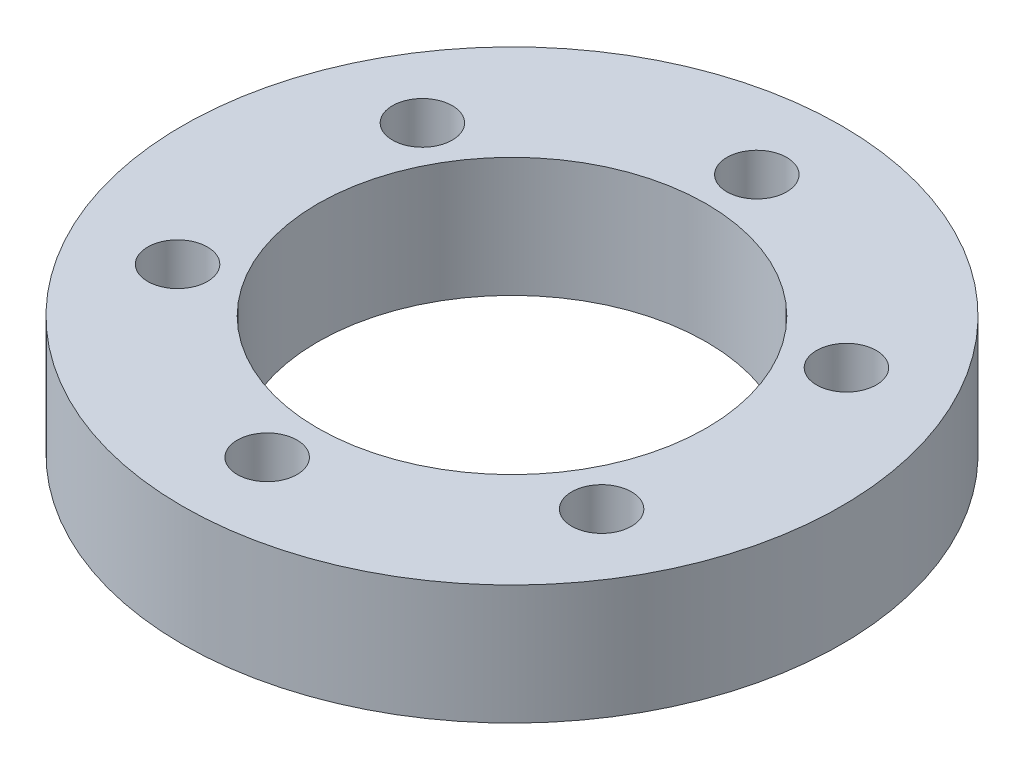
from build123d import *

# Parameters (mm, degrees)
SKETCH1_R           = 35
SKETCH1_R_2         = 10
BOSS_EXTRUDE1_DEPTH = 12.7
SKETCH3_R           = 20.6375
CUT_EXTRUDE1_DEPTH  = 12.7
SKETCH4_R           = 3.175
CUT_EXTRUDE2_DEPTH  = 52.100782773
CIRPATTERN1_COUNT   = 6


with BuildPart() as part:
    # Sketch1 → Boss-Extrude1 (new body)
    with BuildSketch(Plane(origin=(0, 0, 0), x_dir=(1, 0, 0), z_dir=(0, 1, 0))):
        Circle(SKETCH1_R)
        Circle(SKETCH1_R_2, mode=Mode.SUBTRACT)
    extrude(amount=-BOSS_EXTRUDE1_DEPTH)

    # Sketch3 → Cut-Extrude1 (cut)
    with BuildSketch(Plane.XZ.offset(12.7)):
        Circle(SKETCH3_R)
    extrude(amount=-CUT_EXTRUDE1_DEPTH, mode=Mode.SUBTRACT)

    # Sketch4 → Cut-Extrude2 (cut, through all)
    with BuildSketch(Plane.XZ.offset(12.7)):
        with Locations((0, 26)):
            Circle(SKETCH4_R)
    cut_extrude2 = extrude(amount=-CUT_EXTRUDE2_DEPTH, mode=Mode.SUBTRACT)

    # CirPattern1: Cut-Extrude2 ×6 about axis
    cirpattern1_axis = Axis((0, -12.7, 0), (0, -1, 0))
    for i in range(1, CIRPATTERN1_COUNT):
        add(cut_extrude2.rotate(cirpattern1_axis, i * 360 / CIRPATTERN1_COUNT), mode=Mode.SUBTRACT)


solid = part.part
